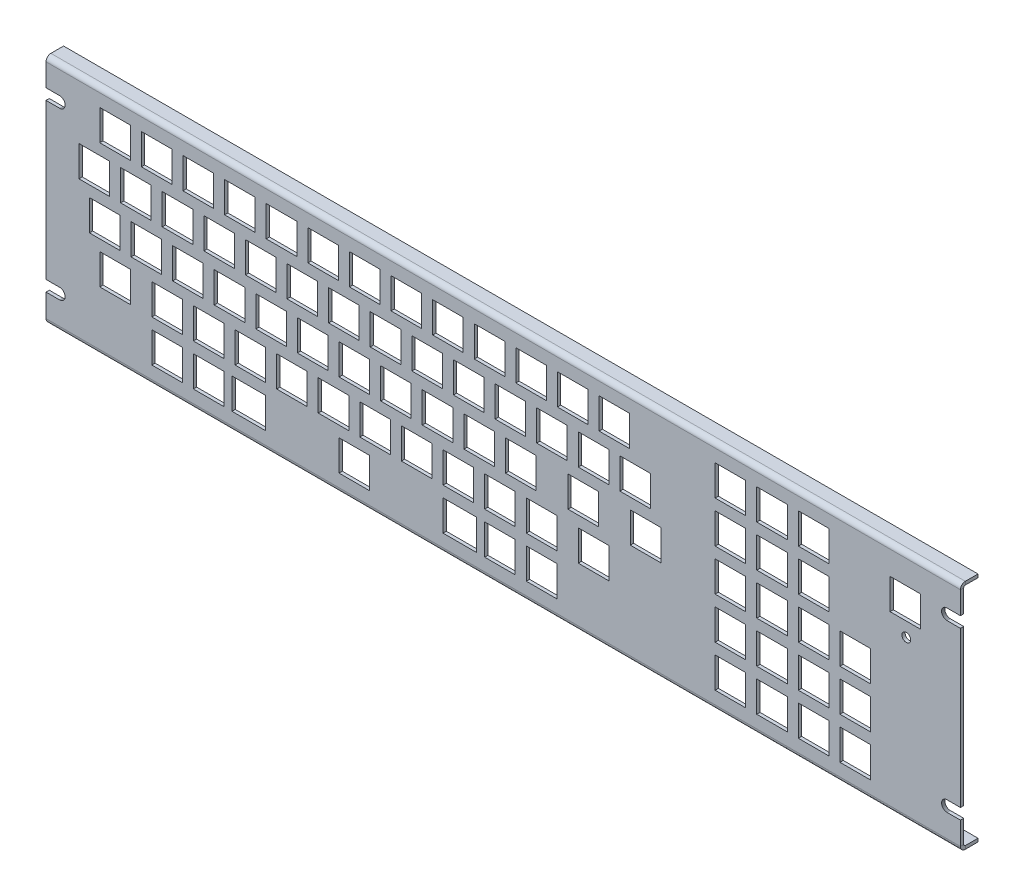
from build123d import *

# Parameters (mm, degrees)
MODEL_R                = 2
MODEL_W                = 14
MODEL_H                = 14
BASE_FLANGE1_DEPTH     = 1.5
SKETCHED_START         = -13.87500635
SKETCHED_BEND1_DEPTH   = 418.67500635
SKETCHED_BEND1_2_DEPTH = 418.67500635
SKETCH12_R             = 2
BOSS_EXTRUDE4_DEPTH    = 1.5
SKETCH14_W             = 14
SKETCH14_H             = 14
CUT_EXTRUDE2_DEPTH     = 422.76606267
SKETCH16_W             = 1.375
SKETCH16_H             = 14
CUT_EXTRUDE3_DEPTH     = 422.791989514


# Read off the part's stored shape, not the designer's step: Sketched Bend1
# Sheet-metal steps are written as plain solids
with BuildPart() as part:
    # Model → Base-Flange1 (new body)
    with BuildSketch(Plane.XY):
        Polygon((404.8, -10), (404.8, -24.5), (398.662814326, -24.5), (398.591424199, -24.501019518), (398.520092298, -24.50407724), (398.448876804, -24.509170673), (398.377835801, -24.516295662), (398.30702723, -24.525446395), (398.236508844, -24.53661541), (398.166338159, -24.549793597), (398.096572407, -24.564970208), (398.02726849, -24.582132863), (397.958482934, -24.601267566), (397.89027184, -24.622358709), (397.822690843, -24.645389091), (397.755795062, -24.670339927), (397.68963906, -24.697190867), (397.624276793, -24.725920012), (397.559761573, -24.756503928), (397.496146018, -24.788917673), (397.433482014, -24.823134807), (397.371820672, -24.859127424), (397.311212282, -24.896866168), (397.251706278, -24.936320258), (397.193351195, -24.977457514), (397.136194627, -25.020244385), (397.080283191, -25.064645973), (397.025662491, -25.110626064), (396.972377075, -25.158147155), (396.920470404, -25.207170488), (396.869984814, -25.257656078), (396.820961481, -25.309562749), (396.77344039, -25.362848165), (396.727460299, -25.417468865), (396.683058711, -25.473380301), (396.64027184, -25.530536869), (396.599134583, -25.588891953), (396.559680494, -25.648397956), (396.52194175, -25.709006346), (396.485949133, -25.770667688), (396.451731998, -25.833331692), (396.419318254, -25.896947247), (396.388734337, -25.961462467), (396.360005193, -26.026824734), (396.333154253, -26.092980737), (396.308203417, -26.159876517), (396.285173035, -26.227457514), (396.264081892, -26.295668608), (396.244947189, -26.364454165), (396.227784533, -26.433758081), (396.212607923, -26.503523833), (396.199429736, -26.573694518), (396.188260721, -26.644212904), (396.179109987, -26.715021475), (396.171984998, -26.786062479), (396.166891566, -26.857277973), (396.163833844, -26.928609873), (396.162814326, -27), (396.163833844, -27.071390127), (396.166891566, -27.142722027), (396.171984998, -27.213937521), (396.179109987, -27.284978525), (396.188260721, -27.355787096), (396.199429736, -27.426305482), (396.212607923, -27.496476167), (396.227784533, -27.566241919), (396.244947189, -27.635545835), (396.264081892, -27.704331392), (396.285173035, -27.772542486), (396.308203417, -27.840123483), (396.333154253, -27.907019263), (396.360005193, -27.973175266), (396.388734337, -28.038537533), (396.419318254, -28.103052753), (396.451731998, -28.166668308), (396.485949133, -28.229332312), (396.52194175, -28.290993654), (396.559680494, -28.351602044), (396.599134583, -28.411108047), (396.64027184, -28.469463131), (396.683058711, -28.526619699), (396.727460299, -28.582531135), (396.77344039, -28.637151835), (396.820961481, -28.690437251), (396.869984814, -28.742343922), (396.920470404, -28.792829512), (396.972377075, -28.841852845), (397.025662491, -28.889373936), (397.080283191, -28.935354027), (397.136194627, -28.979755615), (397.193351195, -29.022542486), (397.251706278, -29.063679742), (397.311212282, -29.103133832), (397.371820672, -29.140872576), (397.433482014, -29.176865193), (397.496146018, -29.211082327), (397.559761573, -29.243496072), (397.624276793, -29.274079988), (397.68963906, -29.302809133), (397.755795062, -29.329660073), (397.822690843, -29.354610909), (397.89027184, -29.377641291), (397.958482934, -29.398732434), (398.02726849, -29.417867137), (398.096572407, -29.435029792), (398.166338159, -29.450206403), (398.236508844, -29.46338459), (398.30702723, -29.474553605), (398.377835801, -29.483704338), (398.448876804, -29.490829327), (398.520092298, -29.49592276), (398.591424199, -29.498980482), (398.662814326, -29.5), (404.8, -29.5), (404.8, -100.55), (398.662814326, -100.55), (398.591424195, -100.551019513), (398.520092291, -100.55407723), (398.448876794, -100.559170658), (398.377835786, -100.566295642), (398.307027211, -100.575446371), (398.236508821, -100.586615382), (398.166338132, -100.599793565), (398.096572376, -100.614970171), (398.027268454, -100.632132823), (397.958482893, -100.651267523), (397.890271795, -100.672358663), (397.822690793, -100.695389042), (397.755795008, -100.720339875), (397.689639001, -100.747190813), (397.62427673, -100.775919955), (397.559761504, -100.80650387), (397.496145945, -100.838917612), (397.433481936, -100.873134745), (397.371820589, -100.909127361), (397.311212195, -100.946866103), (397.251706187, -100.986320192), (397.193351099, -101.027457448), (397.136194526, -101.070244319), (397.080283086, -101.114645906), (397.025662381, -101.160625997), (396.97237696, -101.208147088), (396.920470285, -101.257170422), (396.869984691, -101.307656012), (396.820961354, -101.359562684), (396.773440258, -101.412848101), (396.727460163, -101.467468802), (396.683058571, -101.523380239), (396.640271696, -101.580536808), (396.599134436, -101.638891894), (396.559680343, -101.698397899), (396.521941596, -101.75900629), (396.485948976, -101.820667635), (396.451731838, -101.883331641), (396.419318091, -101.946947198), (396.388734171, -102.011462421), (396.360005024, -102.07682469), (396.333154081, -102.142980695), (396.308203243, -102.209876478), (396.285172859, -102.277457478), (396.264081714, -102.345668575), (396.244947009, -102.414454135), (396.227784352, -102.483758055), (396.21260774, -102.55352381), (396.199429552, -102.623694498), (396.188260536, -102.694212887), (396.179109801, -102.765021462), (396.171984812, -102.836062468), (396.166891379, -102.907277966), (396.163833656, -102.978609869), (396.162814138, -103.05), (396.163833656, -103.12139013), (396.166891379, -103.192722034), (396.171984812, -103.263937531), (396.179109801, -103.334978538), (396.188260536, -103.405787112), (396.199429552, -103.476305501), (396.21260774, -103.54647619), (396.227784352, -103.616241945), (396.244947009, -103.685545865), (396.264081714, -103.754331425), (396.285172859, -103.822542521), (396.308203243, -103.890123521), (396.333154081, -103.957019304), (396.360005024, -104.023175309), (396.388734171, -104.088537579), (396.41931809, -104.153052802), (396.451731838, -104.216668359), (396.485948975, -104.279332365), (396.521941596, -104.340993709), (396.559680343, -104.401602101), (396.599134436, -104.461108106), (396.640271696, -104.519463191), (396.683058571, -104.576619761), (396.727460163, -104.632531198), (396.773440258, -104.687151899), (396.820961353, -104.740437316), (396.86998469, -104.792343987), (396.920470285, -104.842829578), (396.97237696, -104.891852911), (397.02566238, -104.939374003), (397.080283085, -104.985354093), (397.136194525, -105.029755681), (397.193351098, -105.072542552), (397.251706186, -105.113679808), (397.311212195, -105.153133896), (397.371820589, -105.190872639), (397.433481936, -105.226865255), (397.496145944, -105.261082388), (397.559761504, -105.29349613), (397.624276729, -105.324080045), (397.689639001, -105.352809187), (397.755795008, -105.379660125), (397.822690793, -105.404610958), (397.890271794, -105.427641337), (397.958482893, -105.448732477), (398.027268454, -105.467867176), (398.096572375, -105.485029829), (398.166338131, -105.500206435), (398.236508821, -105.513384618), (398.307027211, -105.524553629), (398.377835786, -105.533704358), (398.448876793, -105.540829342), (398.520092291, -105.54592277), (398.591424195, -105.548980487), (398.662814325, -105.55), (404.8, -105.55), (404.8, -117), (404.8, -123.2001524), (-13.87500635, -123.2001524), (-13.87500635, -117), (-13.87500635, -105.5), (-7.629032258, -105.5), (-7.557642128, -105.498980487), (-7.486310224, -105.49592277), (-7.415094726, -105.490829342), (-7.344053719, -105.483704358), (-7.273245144, -105.474553629), (-7.202726754, -105.463384618), (-7.132556064, -105.450206435), (-7.062790308, -105.435029829), (-6.993486387, -105.417867177), (-6.924700826, -105.398732477), (-6.856489727, -105.377641337), (-6.788908726, -105.354610958), (-6.722012941, -105.329660125), (-6.655856934, -105.302809187), (-6.590494662, -105.274080045), (-6.525979437, -105.24349613), (-6.462363877, -105.211082388), (-6.399699869, -105.176865255), (-6.338038522, -105.140872639), (-6.277430127, -105.103133897), (-6.217924119, -105.063679808), (-6.159569031, -105.022542552), (-6.102412458, -104.979755681), (-6.046501018, -104.935354094), (-5.991880313, -104.889374003), (-5.938594893, -104.841852912), (-5.886688218, -104.792829578), (-5.836202623, -104.742343988), (-5.787179286, -104.690437316), (-5.739658191, -104.637151899), (-5.693678096, -104.582531198), (-5.649276504, -104.526619761), (-5.606489629, -104.469463192), (-5.565352369, -104.411108106), (-5.525898275, -104.351602101), (-5.488159529, -104.29099371), (-5.452166908, -104.229332365), (-5.41794977, -104.166668359), (-5.385536023, -104.103052802), (-5.354952104, -104.038537579), (-5.326222956, -103.97317531), (-5.299372014, -103.907019305), (-5.274421175, -103.840123522), (-5.251390792, -103.772542522), (-5.230299646, -103.704331425), (-5.211164942, -103.635545865), (-5.194002284, -103.566241945), (-5.178825673, -103.49647619), (-5.165647485, -103.426305502), (-5.154478468, -103.355787113), (-5.145327734, -103.284978538), (-5.138202744, -103.213937532), (-5.133109311, -103.142722034), (-5.130051589, -103.071390131), (-5.129032071, -103), (-5.130051589, -102.92860987), (-5.133109311, -102.857277966), (-5.138202744, -102.786062469), (-5.145327734, -102.715021462), (-5.154478468, -102.644212888), (-5.165647484, -102.573694499), (-5.178825673, -102.50352381), (-5.194002284, -102.433758055), (-5.211164942, -102.364454135), (-5.230299646, -102.295668575), (-5.251390791, -102.227457479), (-5.274421175, -102.159876479), (-5.299372014, -102.092980696), (-5.326222956, -102.026824691), (-5.354952103, -101.961462421), (-5.385536023, -101.896947198), (-5.41794977, -101.833331641), (-5.452166908, -101.770667635), (-5.488159528, -101.709006291), (-5.525898275, -101.648397899), (-5.565352368, -101.588891894), (-5.606489629, -101.530536809), (-5.649276503, -101.473380239), (-5.693678096, -101.417468802), (-5.73965819, -101.362848101), (-5.787179286, -101.309562684), (-5.836202623, -101.257656013), (-5.886688217, -101.207170422), (-5.938594892, -101.158147089), (-5.991880313, -101.110625997), (-6.046501018, -101.064645907), (-6.102412458, -101.020244319), (-6.159569031, -100.977457448), (-6.217924119, -100.936320192), (-6.277430127, -100.896866104), (-6.338038521, -100.859127361), (-6.399699868, -100.823134745), (-6.462363877, -100.788917612), (-6.525979436, -100.75650387), (-6.590494662, -100.725919955), (-6.655856933, -100.697190813), (-6.72201294, -100.670339875), (-6.788908725, -100.645389042), (-6.856489727, -100.622358663), (-6.924700825, -100.601267523), (-6.993486386, -100.582132824), (-7.062790308, -100.564970171), (-7.132556064, -100.549793565), (-7.202726753, -100.536615382), (-7.273245143, -100.525446371), (-7.344053718, -100.516295642), (-7.415094726, -100.509170658), (-7.486310223, -100.50407723), (-7.557642127, -100.501019513), (-7.629032258, -100.5), (-13.87500635, -100.5), (-13.87500635, -29.5), (-7.629032258, -29.5), (-7.557642131, -29.498980482), (-7.486310231, -29.49592276), (-7.415094737, -29.490829327), (-7.344053733, -29.483704338), (-7.273245162, -29.474553605), (-7.202726776, -29.46338459), (-7.132556091, -29.450206403), (-7.06279034, -29.435029792), (-6.993486423, -29.417867137), (-6.924700866, -29.398732434), (-6.856489772, -29.377641291), (-6.788908775, -29.354610909), (-6.722012995, -29.329660073), (-6.655856992, -29.302809133), (-6.590494726, -29.274079988), (-6.525979505, -29.243496072), (-6.46236395, -29.211082327), (-6.399699946, -29.176865193), (-6.338038604, -29.140872576), (-6.277430214, -29.103133832), (-6.217924211, -29.063679742), (-6.159569127, -29.022542486), (-6.102412559, -28.979755615), (-6.046501124, -28.935354027), (-5.991880423, -28.889373936), (-5.938595007, -28.841852845), (-5.886688336, -28.792829512), (-5.836202746, -28.742343922), (-5.787179413, -28.690437251), (-5.739658322, -28.637151835), (-5.693678231, -28.582531135), (-5.649276643, -28.526619699), (-5.606489772, -28.469463131), (-5.565352516, -28.411108047), (-5.525898426, -28.351602044), (-5.488159682, -28.290993654), (-5.452167065, -28.229332312), (-5.417949931, -28.166668308), (-5.385536186, -28.103052753), (-5.35495227, -28.038537533), (-5.326223125, -27.973175266), (-5.299372185, -27.907019263), (-5.274421349, -27.840123483), (-5.251390967, -27.772542486), (-5.230299824, -27.704331392), (-5.211165121, -27.635545835), (-5.194002466, -27.566241919), (-5.178825855, -27.496476167), (-5.165647668, -27.426305482), (-5.154478653, -27.355787096), (-5.14532792, -27.284978525), (-5.138202931, -27.213937521), (-5.133109498, -27.142722027), (-5.130051776, -27.071390127), (-5.129032258, -27), (-5.130051776, -26.928609873), (-5.133109498, -26.857277973), (-5.138202931, -26.786062479), (-5.14532792, -26.715021475), (-5.154478653, -26.644212904), (-5.165647668, -26.573694518), (-5.178825855, -26.503523833), (-5.194002466, -26.433758081), (-5.211165121, -26.364454165), (-5.230299824, -26.295668608), (-5.251390967, -26.227457514), (-5.274421349, -26.159876517), (-5.299372185, -26.092980737), (-5.326223125, -26.026824734), (-5.35495227, -25.961462467), (-5.385536186, -25.896947247), (-5.417949931, -25.833331692), (-5.452167065, -25.770667688), (-5.488159682, -25.709006346), (-5.525898426, -25.648397956), (-5.565352516, -25.588891953), (-5.606489772, -25.530536869), (-5.649276643, -25.473380301), (-5.693678231, -25.417468865), (-5.739658322, -25.362848165), (-5.787179413, -25.309562749), (-5.836202746, -25.257656078), (-5.886688336, -25.207170488), (-5.938595007, -25.158147155), (-5.991880423, -25.110626064), (-6.046501124, -25.064645973), (-6.102412559, -25.020244385), (-6.159569127, -24.977457514), (-6.217924211, -24.936320258), (-6.277430214, -24.896866168), (-6.338038604, -24.859127424), (-6.399699946, -24.823134807), (-6.46236395, -24.788917673), (-6.525979505, -24.756503928), (-6.590494726, -24.725920012), (-6.655856992, -24.697190867), (-6.722012995, -24.670339927), (-6.788908775, -24.645389091), (-6.856489772, -24.622358709), (-6.924700866, -24.601267566), (-6.993486423, -24.582132863), (-7.06279034, -24.564970208), (-7.132556091, -24.549793597), (-7.202726776, -24.53661541), (-7.273245162, -24.525446395), (-7.344053733, -24.516295662), (-7.415094737, -24.509170673), (-7.486310231, -24.50407724), (-7.557642131, -24.501019518), (-7.629032258, -24.5), (-13.87500635, -24.5), (-13.87500635, -10), (-13.87500635, -7), (404.8, -7), align=None)
        with Locations((5.1501143, -27)):
            Circle(MODEL_R, mode=Mode.SUBTRACT)
        with Locations((5.1501143, -103.0500381)):
            Circle(MODEL_R, mode=Mode.SUBTRACT)
        with Locations((380, -103.1998984)):
            Circle(MODEL_R, mode=Mode.SUBTRACT)
        with Locations((98.712979426, -98)):
            Circle(MODEL_R, mode=Mode.SUBTRACT)
        with Locations((155.863093726, -98)):
            Circle(MODEL_R, mode=Mode.SUBTRACT)
        with Locations((236.822961646, -103.2)):
            Circle(MODEL_R, mode=Mode.SUBTRACT)
        with Locations((285.737998476, -103.1998984)):
            Circle(MODEL_R, mode=Mode.SUBTRACT)
        with Locations((285.737998476, -65.1000762)):
            Circle(MODEL_R, mode=Mode.SUBTRACT)
        with Locations((285.737998476, -26.7500635)):
            Circle(MODEL_R, mode=Mode.SUBTRACT)
        with Locations((380, -18.500127)):
            Circle(MODEL_R, mode=Mode.SUBTRACT)
        with Locations((380, -45.500127)):
            Circle(MODEL_R, mode=Mode.SUBTRACT)
        with Locations((55.85, -27)):
            Rectangle(MODEL_W, MODEL_H, mode=Mode.SUBTRACT)
        with Locations((17.75, -27)):
            Rectangle(MODEL_W, MODEL_H, mode=Mode.SUBTRACT)
        with Locations((36.8, -27)):
            Rectangle(MODEL_W, MODEL_H, mode=Mode.SUBTRACT)
        with Locations((74.9000508, -27)):
            Rectangle(MODEL_W, MODEL_H, mode=Mode.SUBTRACT)
        with Locations((93.9500889, -27)):
            Rectangle(MODEL_W, MODEL_H, mode=Mode.SUBTRACT)
        with Locations((113.000127, -27)):
            Rectangle(MODEL_W, MODEL_H, mode=Mode.SUBTRACT)
        with Locations((132.0499111, -27)):
            Rectangle(MODEL_W, MODEL_H, mode=Mode.SUBTRACT)
        with Locations((151.0999492, -27)):
            Rectangle(MODEL_W, MODEL_H, mode=Mode.SUBTRACT)
        with Locations((170.1499873, -27)):
            Rectangle(MODEL_W, MODEL_H, mode=Mode.SUBTRACT)
        with Locations((189.2000254, -27)):
            Rectangle(MODEL_W, MODEL_H, mode=Mode.SUBTRACT)
        with Locations((208.2500635, -27)):
            Rectangle(MODEL_W, MODEL_H, mode=Mode.SUBTRACT)
        with Locations((227.3001016, -27)):
            Rectangle(MODEL_W, MODEL_H, mode=Mode.SUBTRACT)
        with Locations((246.3501397, -27)):
            Rectangle(MODEL_W, MODEL_H, mode=Mode.SUBTRACT)
        with Locations((299.488061976, -27)):
            Rectangle(MODEL_W, MODEL_H, mode=Mode.SUBTRACT)
        with Locations((299.488061976, -46.0497841)):
            Rectangle(MODEL_W, MODEL_H, mode=Mode.SUBTRACT)
        with Locations((255.87490475, -46.0497841)):
            Rectangle(MODEL_W, MODEL_H, mode=Mode.SUBTRACT)
        with Locations((236.82512065, -46.0497841)):
            Rectangle(MODEL_W, MODEL_H, mode=Mode.SUBTRACT)
        with Locations((217.77508255, -46.0497841)):
            Rectangle(MODEL_W, MODEL_H, mode=Mode.SUBTRACT)
        with Locations((198.72504445, -46.0497841)):
            Rectangle(MODEL_W, MODEL_H, mode=Mode.SUBTRACT)
        with Locations((318.538100076, -27)):
            Rectangle(MODEL_W, MODEL_H, mode=Mode.SUBTRACT)
        with Locations((337.588138176, -27)):
            Rectangle(MODEL_W, MODEL_H, mode=Mode.SUBTRACT)
        with Locations((318.538100076, -46.0497841)):
            Rectangle(MODEL_W, MODEL_H, mode=Mode.SUBTRACT)
        with Locations((337.588138176, -46.0497841)):
            Rectangle(MODEL_W, MODEL_H, mode=Mode.SUBTRACT)
        with Locations((299.488315977, -65.1000762)):
            Rectangle(MODEL_W, MODEL_H, mode=Mode.SUBTRACT)
        with Locations((318.538100076, -65.1000762)):
            Rectangle(MODEL_W, MODEL_H, mode=Mode.SUBTRACT)
        with Locations((337.588138176, -65.1000762)):
            Rectangle(MODEL_W, MODEL_H, mode=Mode.SUBTRACT)
        with Locations((299.488061976, -84.1498603)):
            Rectangle(MODEL_W, MODEL_H, mode=Mode.SUBTRACT)
        with Locations((318.538100076, -84.1498603)):
            Rectangle(MODEL_W, MODEL_H, mode=Mode.SUBTRACT)
        with Locations((337.588138176, -84.1498603)):
            Rectangle(MODEL_W, MODEL_H, mode=Mode.SUBTRACT)
        with Locations((337.588900178, -103.199136398)):
            Rectangle(MODEL_W, MODEL_H, mode=Mode.SUBTRACT)
        with Locations((318.538100076, -103.1998984)):
            Rectangle(MODEL_W, MODEL_H, mode=Mode.SUBTRACT)
        with Locations((299.488061976, -103.1998984)):
            Rectangle(MODEL_W, MODEL_H, mode=Mode.SUBTRACT)
        with Locations((260.638430277, -65.099568199)):
            Rectangle(MODEL_W, MODEL_H, mode=Mode.SUBTRACT)
        with Locations((236.82512065, -84.1498603)):
            Rectangle(MODEL_W, MODEL_H, mode=Mode.SUBTRACT)
        with Locations((379.598806198, -31.999237998)):
            Rectangle(MODEL_W, MODEL_H, mode=Mode.SUBTRACT)
        with Locations((213.013081026, -84.1498603)):
            Rectangle(MODEL_W, MODEL_H, mode=Mode.SUBTRACT)
        with Locations((203.488061976, -65.1000762)):
            Rectangle(MODEL_W, MODEL_H, mode=Mode.SUBTRACT)
        with Locations((213.013081026, -103.1998984)):
            Rectangle(MODEL_W, MODEL_H, mode=Mode.SUBTRACT)
        with Locations((193.963296927, -103.2001524)):
            Rectangle(MODEL_W, MODEL_H, mode=Mode.SUBTRACT)
        with Locations((193.963042926, -84.1498603)):
            Rectangle(MODEL_W, MODEL_H, mode=Mode.SUBTRACT)
        with Locations((174.913004826, -84.1498603)):
            Rectangle(MODEL_W, MODEL_H, mode=Mode.SUBTRACT)
        with Locations((184.438023876, -65.0998222)):
            Rectangle(MODEL_W, MODEL_H, mode=Mode.SUBTRACT)
        with Locations((179.67500635, -46.0497841)):
            Rectangle(MODEL_W, MODEL_H, mode=Mode.SUBTRACT)
        with Locations((160.62496825, -46.0497841)):
            Rectangle(MODEL_W, MODEL_H, mode=Mode.SUBTRACT)
        with Locations((165.387985776, -65.0998222)):
            Rectangle(MODEL_W, MODEL_H, mode=Mode.SUBTRACT)
        with Locations((141.57493015, -46.0497841)):
            Rectangle(MODEL_W, MODEL_H, mode=Mode.SUBTRACT)
        with Locations((146.337947676, -65.0998222)):
            Rectangle(MODEL_W, MODEL_H, mode=Mode.SUBTRACT)
        with Locations((155.862966726, -84.1498603)):
            Rectangle(MODEL_W, MODEL_H, mode=Mode.SUBTRACT)
        with Locations((8.22491745, -46.0497841)):
            Rectangle(MODEL_W, MODEL_H, mode=Mode.SUBTRACT)
        with Locations((27.27495555, -46.0497841)):
            Rectangle(MODEL_W, MODEL_H, mode=Mode.SUBTRACT)
        with Locations((46.32499365, -46.0497841)):
            Rectangle(MODEL_W, MODEL_H, mode=Mode.SUBTRACT)
        with Locations((65.37503175, -46.0497841)):
            Rectangle(MODEL_W, MODEL_H, mode=Mode.SUBTRACT)
        with Locations((84.42506985, -46.0497841)):
            Rectangle(MODEL_W, MODEL_H, mode=Mode.SUBTRACT)
        with Locations((103.47510795, -46.0497841)):
            Rectangle(MODEL_W, MODEL_H, mode=Mode.SUBTRACT)
        with Locations((122.52489205, -46.0497841)):
            Rectangle(MODEL_W, MODEL_H, mode=Mode.SUBTRACT)
        with Locations((127.287909576, -65.0998222)):
            Rectangle(MODEL_W, MODEL_H, mode=Mode.SUBTRACT)
        with Locations((136.812928626, -84.1498603)):
            Rectangle(MODEL_W, MODEL_H, mode=Mode.SUBTRACT)
        with Locations((108.238125476, -65.0998222)):
            Rectangle(MODEL_W, MODEL_H, mode=Mode.SUBTRACT)
        with Locations((89.188087376, -65.0998222)):
            Rectangle(MODEL_W, MODEL_H, mode=Mode.SUBTRACT)
        with Locations((70.138049276, -65.1000762)):
            Rectangle(MODEL_W, MODEL_H, mode=Mode.SUBTRACT)
        with Locations((51.088011176, -65.1000762)):
            Rectangle(MODEL_W, MODEL_H, mode=Mode.SUBTRACT)
        with Locations((32.037973076, -65.1000762)):
            Rectangle(MODEL_W, MODEL_H, mode=Mode.SUBTRACT)
        with Locations((12.987934976, -65.0998222)):
            Rectangle(MODEL_W, MODEL_H, mode=Mode.SUBTRACT)
        with Locations((17.7499365, -84.1498603)):
            Rectangle(MODEL_W, MODEL_H, mode=Mode.SUBTRACT)
        with Locations((41.562992126, -84.1498603)):
            Rectangle(MODEL_W, MODEL_H, mode=Mode.SUBTRACT)
        with Locations((60.613030226, -84.1498603)):
            Rectangle(MODEL_W, MODEL_H, mode=Mode.SUBTRACT)
        with Locations((79.663068326, -84.1498603)):
            Rectangle(MODEL_W, MODEL_H, mode=Mode.SUBTRACT)
        with Locations((98.713106426, -84.1498603)):
            Rectangle(MODEL_W, MODEL_H, mode=Mode.SUBTRACT)
        with Locations((117.763144526, -84.1498603)):
            Rectangle(MODEL_W, MODEL_H, mode=Mode.SUBTRACT)
        with Locations((60.613284227, -103.2001524)):
            Rectangle(MODEL_W, MODEL_H, mode=Mode.SUBTRACT)
        with Locations((41.563246126, -103.1998984)):
            Rectangle(MODEL_W, MODEL_H, mode=Mode.SUBTRACT)
        with Locations((356.638176276, -65.0998222)):
            Rectangle(MODEL_W, MODEL_H, mode=Mode.SUBTRACT)
        with Locations((356.638176276, -84.1498603)):
            Rectangle(MODEL_W, MODEL_H, mode=Mode.SUBTRACT)
        with Locations((356.637922276, -103.199644399)):
            Rectangle(MODEL_W, MODEL_H, mode=Mode.SUBTRACT)
        with Locations((232.063373127, -65.099568199)):
            Rectangle(MODEL_W, MODEL_H, mode=Mode.SUBTRACT)
        with Locations((127.287909576, -103.1998984)):
            Rectangle(MODEL_W, MODEL_H, mode=Mode.SUBTRACT)
    extrude(amount=-BASE_FLANGE1_DEPTH)

    # Sketched Bend1 outline → Sketched Bend1 (cut)
    with BuildSketch(Plane.YZ.offset(SKETCHED_START)):
        with BuildLine():
            Line((-123.2001524, -1.5), (-118.115642246, -1.5))
            ThreePointArc((-118.115642246, -1.5), (-117.298982472, -0.413161062), (-116.00381839, 0))
            Line((-116.00381839, 0), (-123.2001524, 0))
            Line((-123.2001524, 0), (-123.2001524, -1.5))
        make_face()
        with BuildLine():
            ThreePointArc((-14.19633401, 0), (-12.901169928, -0.413161062), (-12.084510154, -1.5))
            Line((-12.084510154, -1.5), (-7, -1.5))
            Line((-7, -1.5), (-7, 0))
            Line((-7, 0), (-14.19633401, 0))
        make_face()
    extrude(amount=SKETCHED_BEND1_DEPTH, mode=Mode.SUBTRACT)

    # Sketched Bend1 2 outline → Sketched Bend1 2 (add)
    with BuildSketch(Plane.YZ.offset(SKETCHED_START)):
        with BuildLine():
            Line((-116.74041839, -8.040265986), (-116.74041839, -2.2366))
            ThreePointArc((-116.74041839, -2.2366), (-116.524673245, -1.715745145), (-116.00381839, -1.5))
            Line((-116.00381839, -1.5), (-118.115642246, -1.5))
            ThreePointArc((-118.115642246, -1.5), (-118.209003733, -1.863053267), (-118.24041839, -2.2366))
            Line((-118.24041839, -2.2366), (-118.24041839, -8.040265986))
            Line((-118.24041839, -8.040265986), (-116.74041839, -8.040265986))
        make_face()
        with BuildLine():
            Line((-12.084510154, -1.5), (-14.19633401, -1.5))
            ThreePointArc((-14.19633401, -1.5), (-13.675479155, -1.715745145), (-13.45973401, -2.2366))
            Line((-13.45973401, -2.2366), (-13.45973401, -8.040265987))
            Line((-13.45973401, -8.040265987), (-11.95973401, -8.040265987))
            Line((-11.95973401, -8.040265987), (-11.95973401, -2.2366))
            ThreePointArc((-11.95973401, -2.2366), (-11.991148667, -1.863053267), (-12.084510154, -1.5))
        make_face()
    extrude(amount=SKETCHED_BEND1_2_DEPTH)

    # Sketch12 → Boss-Extrude4 (add)
    with BuildSketch(Plane.XY):
        with Locations((5.1501143, -27)):
            Circle(SKETCH12_R)
        with Locations((5.1501143, -103.0500381)):
            Circle(SKETCH12_R)
        with Locations((98.712979426, -98)):
            Circle(SKETCH12_R)
        with Locations((155.863093726, -98)):
            Circle(SKETCH12_R)
        with Locations((236.822961646, -103.2)):
            Circle(SKETCH12_R)
        with Locations((285.737998476, -26.7500635)):
            Circle(SKETCH12_R)
        with Locations((285.737998476, -103.1998984)):
            Circle(SKETCH12_R)
        with Locations((285.737998476, -65.1000762)):
            Circle(SKETCH12_R)
        with Locations((380, -18.500127)):
            Circle(SKETCH12_R)
        with Locations((380, -103.1998984)):
            Circle(SKETCH12_R)
    extrude(amount=-BOSS_EXTRUDE4_DEPTH)

    # Sketch14 → Cut-Extrude2 (cut, through all)
    with BuildSketch(Plane(origin=(0, 0, -1.5), x_dir=(-1, 0, 0), z_dir=(0, 0, -1))):
        with Locations((-79.663830328, -103.199136398)):
            Rectangle(SKETCH14_W, SKETCH14_H)
        with Locations((-174.914020828, -103.199136398)):
            Rectangle(SKETCH14_W, SKETCH14_H)
    extrude(amount=-CUT_EXTRUDE2_DEPTH, mode=Mode.SUBTRACT)

    # Sketch16 → Cut-Extrude3 (cut, through all)
    with BuildSketch(Plane.XY):
        with Locations((182.601520828, -103.199136398)):
            Rectangle(SKETCH16_W, SKETCH16_H)
        with Locations((71.976330328, -103.199136398)):
            Rectangle(SKETCH16_W, SKETCH16_H)
    extrude(amount=-CUT_EXTRUDE3_DEPTH, mode=Mode.SUBTRACT)


solid = part.part
